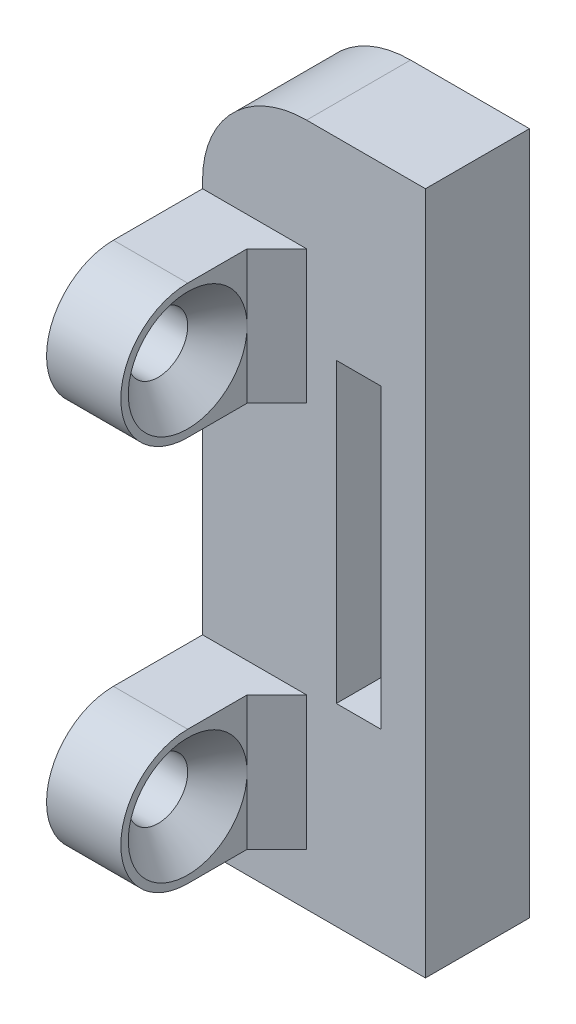
from build123d import *

# Parameters (mm, degrees)
BOSS_EXTRUDE1_DEPTH = 7
SKETCH2_R           = 2
BOSS_EXTRUDE2_DEPTH = 5
CHAMFER1_SIZE       = 2
CHAMFER2_SIZE       = 2
SKETCH3_W           = 3
SKETCH3_H           = 20
CUT_EXTRUDE1_DEPTH  = 38.619808612


with BuildPart() as part:
    # Sketch1 → Boss-Extrude1 (new body)
    with BuildSketch(Plane.XY):
        with BuildLine():
            Line((22, 21), (14, 21))
            ThreePointArc((14, 21), (9.050252532, 18.949747468), (7, 14))
            Line((7, 14), (7, -25))
            Line((7, -25), (22, -25))
            Line((22, -25), (22, 21))
        make_face()
    extrude(amount=BOSS_EXTRUDE1_DEPTH)

    # Sketch2 → Boss-Extrude2 (add)
    with BuildSketch(Plane.ZY.offset(-7)):
        with BuildLine():
            Line((7, 13.5), (13, 13.5))
            ThreePointArc((13, 13.5), (17.5, 9), (13, 4.5))
            Line((13, 4.5), (7, 4.5))
            Line((7, 4.5), (7, 13.5))
        make_face()
        with Locations(Location((13, 9, 0), (0, 0, 270))):
            Circle(SKETCH2_R, mode=Mode.SUBTRACT)
    boss_extrude2 = extrude(amount=-BOSS_EXTRUDE2_DEPTH)

    # Mirror1: Boss-Extrude2 across plane
    add(boss_extrude2.mirror(Plane.ZX.offset(-4)))

    # Chamfer1
    chamfer1_edges = [part.edges().sort_by_distance(p)[0] for p in [
        (12, 11, 13),
        (12, -19, 13),
    ]]
    chamfer(chamfer1_edges, length=CHAMFER1_SIZE)

    # Chamfer2
    chamfer2_edges = [part.edges().sort_by_distance(p)[0] for p in [
        (12, 9, 7),
        (12, -17, 7),
    ]]
    chamfer(chamfer2_edges, length=CHAMFER2_SIZE - 0.0001)  # a hair under: the kernel refuses the full size

    # Sketch3 → Cut-Extrude1 (cut, through all)
    with BuildSketch(Plane(origin=(0, 0, 0), x_dir=(-1, 0, 0), z_dir=(0, 0, -1))):
        with Locations((-17.5, -2)):
            Rectangle(SKETCH3_W, SKETCH3_H)
    extrude(amount=-CUT_EXTRUDE1_DEPTH, mode=Mode.SUBTRACT)


solid = part.part
